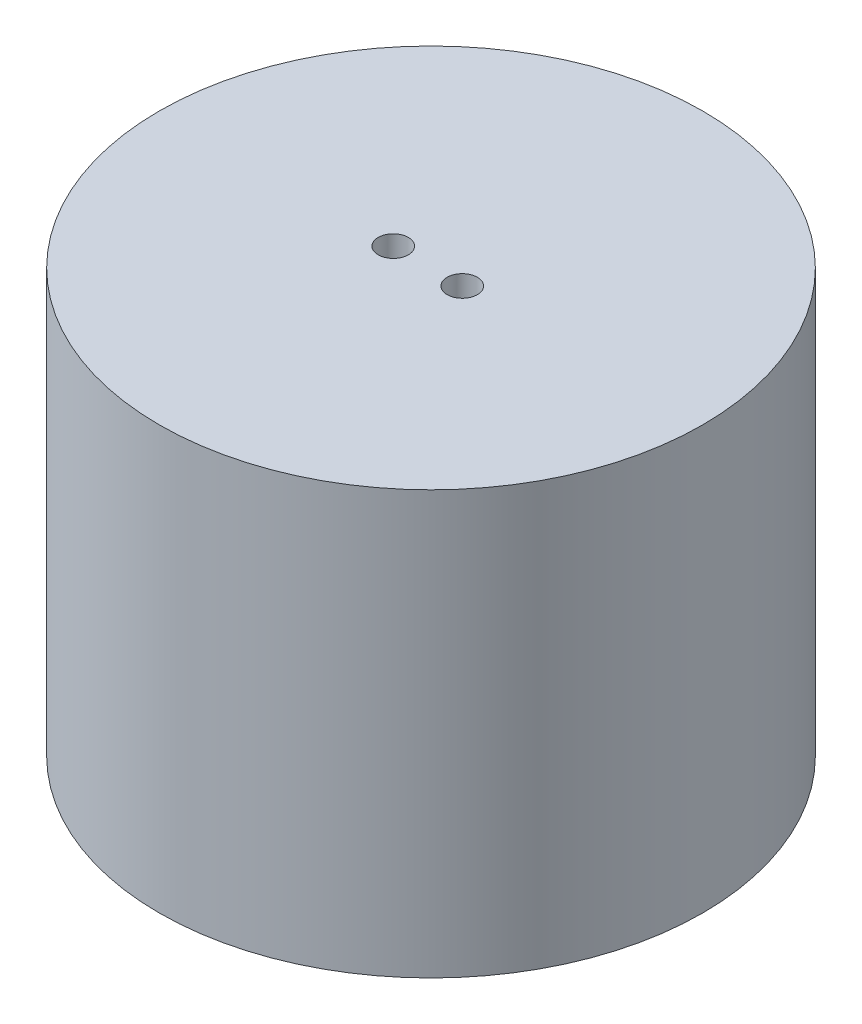
from build123d import *

# Parameters (mm, degrees)
SKETCH1_R           = 9
SKETCH1_R_2         = 7.75
BOSS_EXTRUDE1_DEPTH = 4
SKETCH2_R           = 9
SKETCH2_R_2         = 6
BOSS_EXTRUDE2_DEPTH = 9
THREAD2_PITCH       = 1
THREAD2_TO          = 5
SKETCH3_R           = 9
SKETCH3_R_2         = 0.5
BOSS_EXTRUDE3_DEPTH = 1


with BuildPart() as part:
    # Sketch1 → Boss-Extrude1 (new body)
    with BuildSketch(Plane(origin=(0, 0, 0), x_dir=(1, 0, 0), z_dir=(0, 1, 0))):
        with Locations(Location((0, 0, 0), (0, 0, 270))):
            Circle(SKETCH1_R)
        with Locations(Location((0, 0, 0), (0, 0, 270))):
            Circle(SKETCH1_R_2, mode=Mode.SUBTRACT)
    extrude(amount=BOSS_EXTRUDE1_DEPTH)

    # Sketch2 → Boss-Extrude2 (add)
    with BuildSketch(Plane(origin=(0, 4, 0), x_dir=(1, 0, 0), z_dir=(0, 1, 0))):
        with Locations(Location((0, 0, 0), (0, 0, 270))):
            Circle(SKETCH2_R)
        with Locations(Location((0, 0, 0), (0, 0, 270))):
            Circle(SKETCH2_R_2, mode=Mode.SUBTRACT)
    extrude(amount=BOSS_EXTRUDE2_DEPTH)

    # Thread2: arcs per turn and ends read off the stored shape
    # Thread2: the profile of Thread Profile2 profile screwed along a right-hand helix through 5 turns, 8 arcs to a turn; built about Z, then put on its axis
    thread2_z = Axis((0, 0, 0), (0, 0, 1))
    thread2_corners = [(7.7497, 0, -0.000173205), (8.291265875, 0, 0.312499999), (8.291265875, 0, 0.437499999), (7.7497, 0, 0.750173202)]
    with BuildLine(mode=Mode.PRIVATE) as thread2_profile:
        Line(thread2_corners[0], thread2_corners[1])
        Line(thread2_corners[1], thread2_corners[2])
        Line(thread2_corners[2], thread2_corners[3])
        Line(thread2_corners[3], thread2_corners[0])
    thread2_cap = Face(thread2_profile.wire())
    thread2_turn_angles = [0, 22.5, 45, 67.5, 90, 112.5, 135, 157.5, 180, 202.5, 225, 247.5, 270, 292.5, 315, 337.5, 360]
    thread2_turn_weights = [1, 0.9238795325112867, 1, 0.9238795325112867, 1, 0.9238795325112867, 1, 0.9238795325112867, 1, 0.9238795325112867, 1, 0.9238795325112867, 1, 0.9238795325112867, 1, 0.9238795325112867, 1]
    thread2_turn_rails = [Edge.make_bspline([Vector(p[0], p[1], 0).rotate(thread2_z, thread2_turn_angles[k]) / thread2_turn_weights[k] + Vector(0, 0, p[2] + THREAD2_PITCH * thread2_turn_angles[k] / 360) for k in range(17)], [0, 0, 0, 1, 1, 2, 2, 3, 3, 4, 4, 5, 5, 6, 6, 7, 7, 8, 8, 8], 2, thread2_turn_weights) for p in thread2_corners]
    thread2_turn_sides = [Face.make_surface_from_curves(thread2_turn_rails[p[0]], thread2_turn_rails[p[1]]) for p in [(0, 1), (1, 2), (2, 3), (3, 0)]]
    thread2 = Plane(origin=(0, -1, 0), x_dir=(1, 0, 0), z_dir=(0, 1, 0)) * split(Solid(Shell([*[p.moved(Location((0, 0, THREAD2_PITCH * i))) for i in range(5) for p in thread2_turn_sides], thread2_cap, thread2_cap.rotate(thread2_z, 1800).moved(Location((0, 0, THREAD2_PITCH * 1800 / 360)))])), bisect_by=Plane.XY.offset(THREAD2_TO), keep=Keep.BOTTOM, mode=Mode.PRIVATE)
    add(thread2, mode=Mode.SUBTRACT)

    # Sketch3 → Boss-Extrude3 (add)
    with BuildSketch(Plane(origin=(0, 13, 0), x_dir=(1, 0, 0), z_dir=(0, 1, 0))):
        with Locations(Location((0, 0, 0), (0, 0, 270))):
            Circle(SKETCH3_R)
        with Locations(Location((-1.25, 0, 0), (0, 0, 270))):
            Circle(SKETCH3_R_2, mode=Mode.SUBTRACT)
        with Locations(Location((1.035492966, 0, 0), (0, 0, 270))):
            Circle(SKETCH3_R_2, mode=Mode.SUBTRACT)
    extrude(amount=BOSS_EXTRUDE3_DEPTH)


solid = part.part
